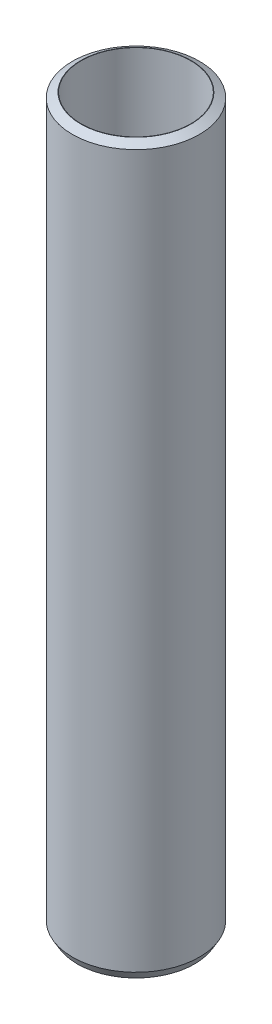
from build123d import *
from OCP.BRepFilletAPI import BRepFilletAPI_MakeChamfer

# Parameters (mm, degrees)
SKETCH1_R           = 52.5
BOSS_EXTRUDE1_DEPTH = 600
SKETCH2_R           = 45.28881108
CUT_EXTRUDE1_DEPTH  = 605.576297914
CHAMFER1_SIZE       = 3.990692187
CHAMFER1_SIZE2      = 6.912081625


with BuildPart() as part:
    # Sketch1 → Boss-Extrude1 (new body)
    with BuildSketch(Plane(origin=(0, 0, 0), x_dir=(1, 0, 0), z_dir=(0, 1, 0))):
        Circle(SKETCH1_R)
    extrude(amount=BOSS_EXTRUDE1_DEPTH)

    # Sketch2 → Cut-Extrude1 (cut, through all)
    with BuildSketch(Plane(origin=(0, 0, 0), x_dir=(1, 0, 0), z_dir=(0, 1, 0))):
        Circle(SKETCH2_R)
    extrude(amount=CUT_EXTRUDE1_DEPTH, mode=Mode.SUBTRACT)

    # Chamfer1: one chamfer whose edges measure the first distance from different faces: ONE call of the kernel's chamfer builder (chamfer() names one face for all edges)
    chamfer1_edges_1 = [part.edges().sort_by_distance(p)[0] for p in [
        (-52.5, 600, 0),
    ]]
    chamfer1_side_1 = [part.faces().sort_by_distance(p)[0] for p in [
        (-52.5, 300, 0),
    ]]
    chamfer1_edges_2 = [part.edges().sort_by_distance(p)[0] for p in [
        (-52.5, 0, 0),
    ]]
    chamfer1_side_2 = [part.faces().sort_by_distance(p)[0] for p in [
        (-51.01507576, 0, 0),
    ]]
    chamfer1 = BRepFilletAPI_MakeChamfer(part.part.solid().wrapped)
    for e in chamfer1_edges_1:
        chamfer1.Add(CHAMFER1_SIZE, CHAMFER1_SIZE2, e.wrapped, chamfer1_side_1[0].wrapped)  # the first distance lies on this face
    for e in chamfer1_edges_2:
        chamfer1.Add(CHAMFER1_SIZE, CHAMFER1_SIZE2, e.wrapped, chamfer1_side_2[0].wrapped)  # the first distance lies on this face
    add(Compound.cast(chamfer1.Shape()), mode=Mode.REPLACE)


solid = part.part
